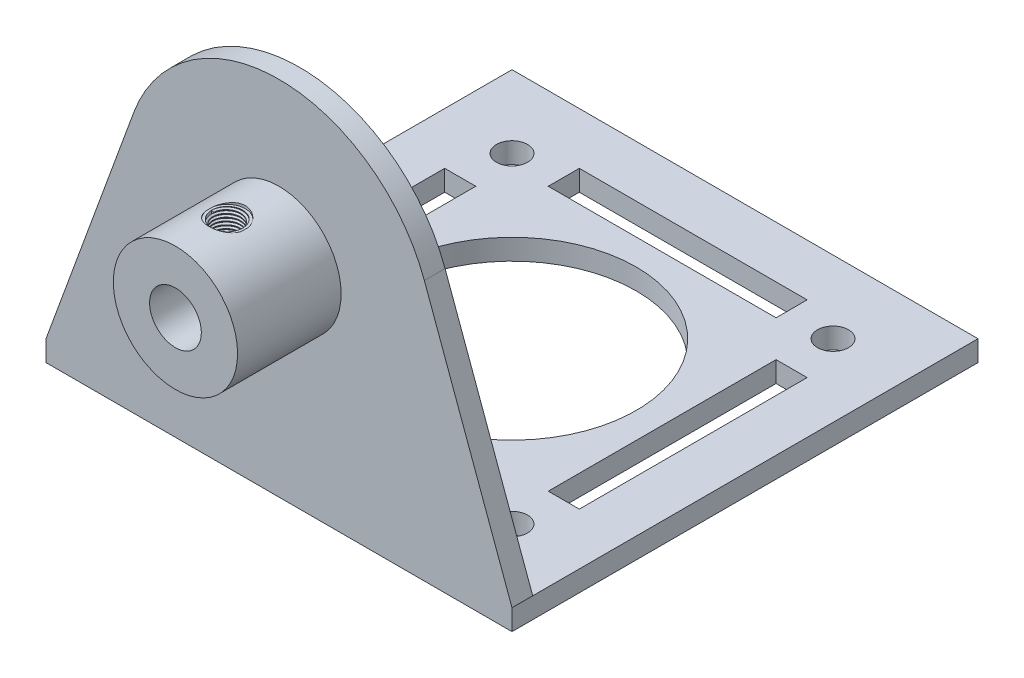
from build123d import *

# Parameters (mm, degrees)
SKETCH_1_W          = 45
SKETCH_1_H          = 45
EXTRUDE_1_DEPTH     = 2
SKETCH_3_R          = 12
SKETCH_3_R_2        = 1.5
CUT_EXTRUDE_1_DEPTH = 10
SKETCH_7_W          = 45
SKETCH_7_H          = 2
EXTRUDE_3_DEPTH     = 40
SKETCH_8_R          = 6
SKETCH_8_R_2        = 2.5
EXTRUDE_4_DEPTH     = 10
CUT_EXTRUDE_3_DEPTH = 10
CUT_EXTRUDE_4_DEPTH = 10
SKETCH_16_R         = 1.75
CUT_EXTRUDE_5_DEPTH = 2.5
SKETCH_17_R         = 1.5
CUT_EXTRUDE_6_DEPTH = 5.75
SKETCH_18_R         = 1.75
CUT_EXTRUDE_8_DEPTH = 11.5
CUT_EXTRUDE_START   = -11.5
SKETCH_19_R         = 1.75
CUT_EXTRUDE_9_DEPTH = 11.5
THREAD_1_PITCH      = 0.3175
THREAD_2_PITCH      = 0.3175


with BuildPart() as part:
    # Sketch 1 → 凸台-拉伸1 (new body)
    with BuildSketch(Plane(origin=(0, 0, 0), x_dir=(1, 0, 0), z_dir=(0, 1, 0))):
        with Locations((22.5, 22.5)):
            Rectangle(SKETCH_1_W, SKETCH_1_H)
    extrude(amount=EXTRUDE_1_DEPTH)

    # 草图3 → 切除-拉伸1 (cut)
    with BuildSketch(Plane(origin=(0, 2, 0), x_dir=(1, 0, 0), z_dir=(0, 1, 0))):
        with Locations(Location((22.5, 22.5, 0), (0, 0, 270))):
            Circle(SKETCH_3_R)
        with Locations(Location((38, 38, 0), (0, 0, 270))):
            Circle(SKETCH_3_R_2)
        with Locations(Location((7, 38, 0), (0, 0, 270))):
            Circle(SKETCH_3_R_2)
        with Locations(Location((7, 7, 0), (0, 0, 270))):
            Circle(SKETCH_3_R_2)
        with Locations(Location((38, 7, 0), (0, 0, 270))):
            Circle(SKETCH_3_R_2)
    extrude(amount=-CUT_EXTRUDE_1_DEPTH, mode=Mode.SUBTRACT)

    # 草图7 → 凸台-拉伸3 (add)
    with BuildSketch(Plane(origin=(0, 2, 0), x_dir=(1, 0, 0), z_dir=(0, 1, 0))):
        with Locations((22.5, 1)):
            Rectangle(SKETCH_7_W, SKETCH_7_H)
    extrude(amount=EXTRUDE_3_DEPTH)

    # 草图8 → 凸台-拉伸4 (add)
    with BuildSketch(Plane.XY):
        with Locations((22.5, 20)):
            Circle(SKETCH_8_R)
        with Locations((22.5, 20)):
            Circle(SKETCH_8_R_2, mode=Mode.SUBTRACT)
    extrude(amount=EXTRUDE_4_DEPTH)

    # 草图10 → 切除-拉伸3 (cut)
    with BuildSketch(Plane.XY):
        with BuildLine():
            Line((0, 42), (0, 2))
            Line((0, 2), (8.463011679, 25.134892858))
            ThreePointArc((8.463011679, 25.134892858), (22.5, 34.946710869), (36.536988321, 25.134892858))
            Line((36.536988321, 25.134892858), (45, 2))
            Line((45, 2), (45, 42))
            Line((45, 42), (0, 42))
        make_face()
    extrude(amount=-CUT_EXTRUDE_3_DEPTH, mode=Mode.SUBTRACT)

    # 草图12 → 切除-拉伸4 (cut)
    with BuildSketch(Plane(origin=(0, 2, 0), x_dir=(1, 0, 0), z_dir=(0, 1, 0))):
        Polygon((5, 22.5), (5, 33.5), (8, 33.5), (8, 11.5), (5, 11.5), align=None)
        Polygon((22.5, 8), (11.5, 8), (11.5, 5), (33.5, 5), (33.5, 8), align=None)
        Polygon((37, 22.5), (37, 11.5), (40, 11.5), (40, 33.5), (37, 33.5), align=None)
        Polygon((22.5, 40), (11.5, 40), (11.5, 37), (33.5, 37), (33.5, 40), align=None)
    extrude(amount=-CUT_EXTRUDE_4_DEPTH, mode=Mode.SUBTRACT)

    # 草图16 → 切除-拉伸5 (cut, symmetric)
    with BuildSketch(Plane(origin=(22.5, 20, 0), x_dir=(1, 0, 0), z_dir=(0, 1, 0))):
        with Locations((0, -5)):
            Circle(SKETCH_16_R)
    extrude(amount=CUT_EXTRUDE_5_DEPTH, both=True, mode=Mode.SUBTRACT)

    # 草图17 → 切除-拉伸6 (cut, symmetric)
    with BuildSketch(Plane(origin=(22.5, 20, 0), x_dir=(1, 0, 0), z_dir=(0, 1, 0))):
        with Locations(Location((0, -5, 0), (0, 0, 180))):
            Circle(SKETCH_17_R)
    extrude(amount=CUT_EXTRUDE_6_DEPTH, both=True, mode=Mode.SUBTRACT)

    # 草图18 → 切除-拉伸8 (cut)
    with BuildSketch(Plane(origin=(0, 14.25, 0), x_dir=(1, 0, 0), z_dir=(0, 1, 0))):
        with Locations((22.5, -5)):
            Circle(SKETCH_18_R)
    extrude(amount=-CUT_EXTRUDE_8_DEPTH, mode=Mode.SUBTRACT)

    # 草图19 → 切除-拉伸9 (cut)
    with BuildSketch(Plane.XZ.offset(-25.75).offset(CUT_EXTRUDE_START)):
        with Locations((22.5, 5)):
            Circle(SKETCH_19_R)
    extrude(amount=CUT_EXTRUDE_9_DEPTH, mode=Mode.SUBTRACT)

    # 螺纹线1: the profile of Sketch 1 2 profile screwed along a right-hand helix of 9.448819 turns, 6 arcs to a turn; built about Z, then put on its axis
    thread_1_z = Axis((0, 0, 0), (0, 0, 1))
    thread_1_corners = [(1.5003, 0, -0.000173205), (1.5003, 0, 0.277985704), (1.328148085, 0, 0.17859375), (1.328148085, 0, 0.09921875)]
    with BuildLine(mode=Mode.PRIVATE) as thread_1_profile:
        Line(thread_1_corners[0], thread_1_corners[1])
        Line(thread_1_corners[1], thread_1_corners[2])
        Line(thread_1_corners[2], thread_1_corners[3])
        Line(thread_1_corners[3], thread_1_corners[0])
    thread_1_cap = Face(thread_1_profile.wire())
    thread_1_turn_angles = [0, 30, 60, 90, 120, 150, 180, 210, 240, 270, 300, 330, 360]
    thread_1_turn_weights = [1, 0.8660254037844387, 1, 0.8660254037844387, 1, 0.8660254037844387, 1, 0.8660254037844387, 1, 0.8660254037844387, 1, 0.8660254037844387, 1]
    thread_1_turn_rails = [Edge.make_bspline([Vector(p[0], p[1], 0).rotate(thread_1_z, thread_1_turn_angles[k]) / thread_1_turn_weights[k] + Vector(0, 0, p[2] + THREAD_1_PITCH * thread_1_turn_angles[k] / 360) for k in range(13)], [0, 0, 0, 1, 1, 2, 2, 3, 3, 4, 4, 5, 5, 6, 6, 6], 2, thread_1_turn_weights) for p in thread_1_corners]
    thread_1_turn_sides = [Face.make_surface_from_curves(thread_1_turn_rails[p[0]], thread_1_turn_rails[p[1]]) for p in [(0, 1), (1, 2), (2, 3), (3, 0)]]
    thread_1_last_angles = [3240, 3270, 3300, 3330, 3360, 3380.787401575, 3401.57480315]
    thread_1_last_weights = [1, 0.8660254037844387, 1, 0.8660254037844387, 1, 0.9349037361358654, 1]
    thread_1_last_rails = [Edge.make_bspline([Vector(p[0], p[1], 0).rotate(thread_1_z, thread_1_last_angles[k]) / thread_1_last_weights[k] + Vector(0, 0, p[2] + THREAD_1_PITCH * thread_1_last_angles[k] / 360) for k in range(7)], [0, 0, 0, 1, 1, 2, 2, 3, 3, 3], 2, thread_1_last_weights) for p in thread_1_corners]
    thread_1_last_sides = [Face.make_surface_from_curves(thread_1_last_rails[p[0]], thread_1_last_rails[p[1]]) for p in [(0, 1), (1, 2), (2, 3), (3, 0)]]
    thread_1 = Plane(origin=(22.5, 14.25, 5), x_dir=(1, 0, 0), z_dir=(0, 1, 0)) * Solid(Shell([*[p.moved(Location((0, 0, THREAD_1_PITCH * i))) for i in range(9) for p in thread_1_turn_sides], *thread_1_last_sides, thread_1_cap, thread_1_cap.rotate(thread_1_z, 3401.57480315).moved(Location((0, 0, THREAD_1_PITCH * 3401.57480315 / 360)))]))
    add(thread_1)

    # 螺纹线2: the profile of 螺纹线轮廓2 profile screwed along a right-hand helix of 9.448819 turns, 6 arcs to a turn; built about Z, then put on its axis
    thread_2_z = Axis((0, 0, 0), (0, 0, 1))
    thread_2_corners = [(1.5003, 0, -0.000173205), (1.5003, 0, 0.277985704), (1.328148085, 0, 0.17859375), (1.328148085, 0, 0.09921875)]
    with BuildLine(mode=Mode.PRIVATE) as thread_2_profile:
        Line(thread_2_corners[0], thread_2_corners[1])
        Line(thread_2_corners[1], thread_2_corners[2])
        Line(thread_2_corners[2], thread_2_corners[3])
        Line(thread_2_corners[3], thread_2_corners[0])
    thread_2_cap = Face(thread_2_profile.wire())
    thread_2_turn_angles = [0, 30, 60, 90, 120, 150, 180, 210, 240, 270, 300, 330, 360]
    thread_2_turn_weights = [1, 0.8660254037844387, 1, 0.8660254037844387, 1, 0.8660254037844387, 1, 0.8660254037844387, 1, 0.8660254037844387, 1, 0.8660254037844387, 1]
    thread_2_turn_rails = [Edge.make_bspline([Vector(p[0], p[1], 0).rotate(thread_2_z, thread_2_turn_angles[k]) / thread_2_turn_weights[k] + Vector(0, 0, p[2] + THREAD_2_PITCH * thread_2_turn_angles[k] / 360) for k in range(13)], [0, 0, 0, 1, 1, 2, 2, 3, 3, 4, 4, 5, 5, 6, 6, 6], 2, thread_2_turn_weights) for p in thread_2_corners]
    thread_2_turn_sides = [Face.make_surface_from_curves(thread_2_turn_rails[p[0]], thread_2_turn_rails[p[1]]) for p in [(0, 1), (1, 2), (2, 3), (3, 0)]]
    thread_2_last_angles = [3240, 3270, 3300, 3330, 3360, 3380.787401575, 3401.57480315]
    thread_2_last_weights = [1, 0.8660254037844387, 1, 0.8660254037844387, 1, 0.9349037361358654, 1]
    thread_2_last_rails = [Edge.make_bspline([Vector(p[0], p[1], 0).rotate(thread_2_z, thread_2_last_angles[k]) / thread_2_last_weights[k] + Vector(0, 0, p[2] + THREAD_2_PITCH * thread_2_last_angles[k] / 360) for k in range(7)], [0, 0, 0, 1, 1, 2, 2, 3, 3, 3], 2, thread_2_last_weights) for p in thread_2_corners]
    thread_2_last_sides = [Face.make_surface_from_curves(thread_2_last_rails[p[0]], thread_2_last_rails[p[1]]) for p in [(0, 1), (1, 2), (2, 3), (3, 0)]]
    thread_2 = Plane(origin=(22.5, 25.75, 5), x_dir=(-1, 0, 0), z_dir=(0, -1, 0)) * Solid(Shell([*[p.moved(Location((0, 0, THREAD_2_PITCH * i))) for i in range(9) for p in thread_2_turn_sides], *thread_2_last_sides, thread_2_cap, thread_2_cap.rotate(thread_2_z, 3401.57480315).moved(Location((0, 0, THREAD_2_PITCH * 3401.57480315 / 360)))]))
    add(thread_2)


solid = part.part
